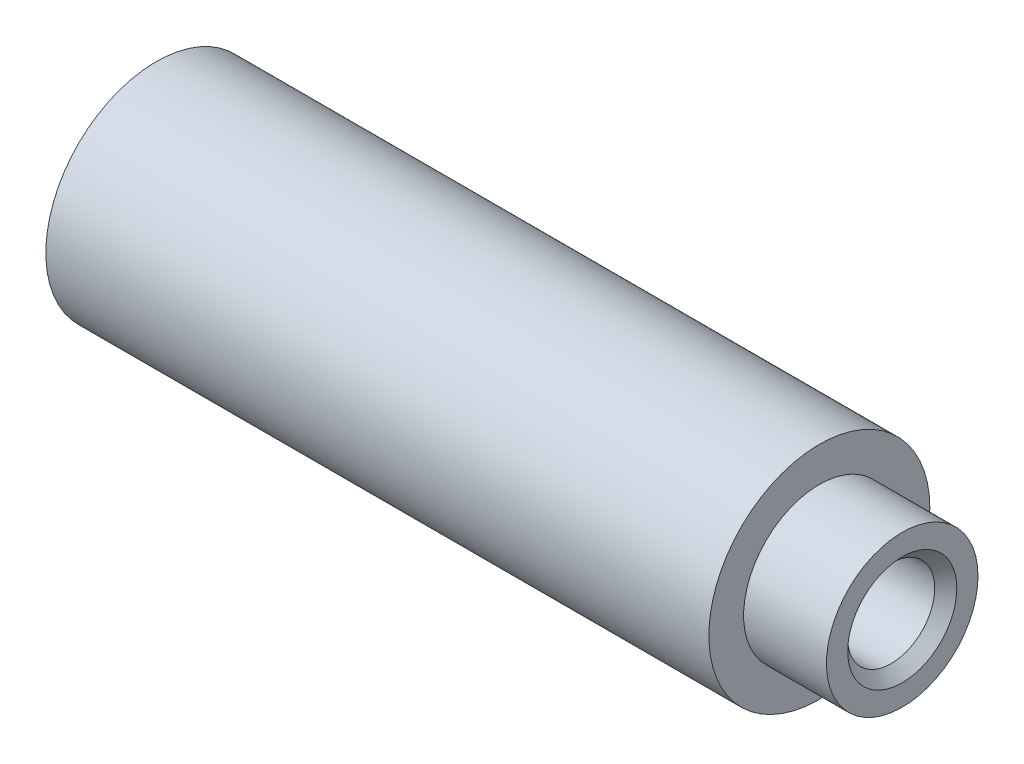
from build123d import *

# Parameters (mm, degrees)
SKIZZE1_R                       = 4
SKIZZE1_R_2                     = 1.575
AUFSATZ_LINEAR_AUSTRAGEN1_DEPTH = 27
SKIZZE2_OUTSIDE_W               = 15.854
SKIZZE2_OUTSIDE_H               = 15.854
SKIZZE2_OUTSIDE_R               = 2.7425
SCHNITT_LINEAR_AUSTRAGEN1_DEPTH = 3
FASE1_SIZE                      = 0.4


with BuildPart() as part:
    # Skizze1 → Aufsatz-Linear austragen1 (new body)
    with BuildSketch(Plane(origin=(0, 0, 0), x_dir=(0, 0, -1), z_dir=(1, 0, 0))):
        Circle(SKIZZE1_R)
        Circle(SKIZZE1_R_2, mode=Mode.SUBTRACT)
    extrude(amount=AUFSATZ_LINEAR_AUSTRAGEN1_DEPTH)

    # Skizze2 outside → Schnitt-Linear austragen1 (cut)
    with BuildSketch(Plane(origin=(27, 0, 0), x_dir=(0, 0, -1), z_dir=(1, 0, 0))):
        Rectangle(SKIZZE2_OUTSIDE_W, SKIZZE2_OUTSIDE_H)
        Circle(SKIZZE2_OUTSIDE_R, mode=Mode.SUBTRACT)
    extrude(amount=-SCHNITT_LINEAR_AUSTRAGEN1_DEPTH, mode=Mode.SUBTRACT)

    # Fase1
    fase1_edges = [part.edges().sort_by_distance(p)[0] for p in [
        (0, 0, 1.575),
        (27, 0, 1.575),
    ]]
    chamfer(fase1_edges, length=FASE1_SIZE)


solid = part.part
